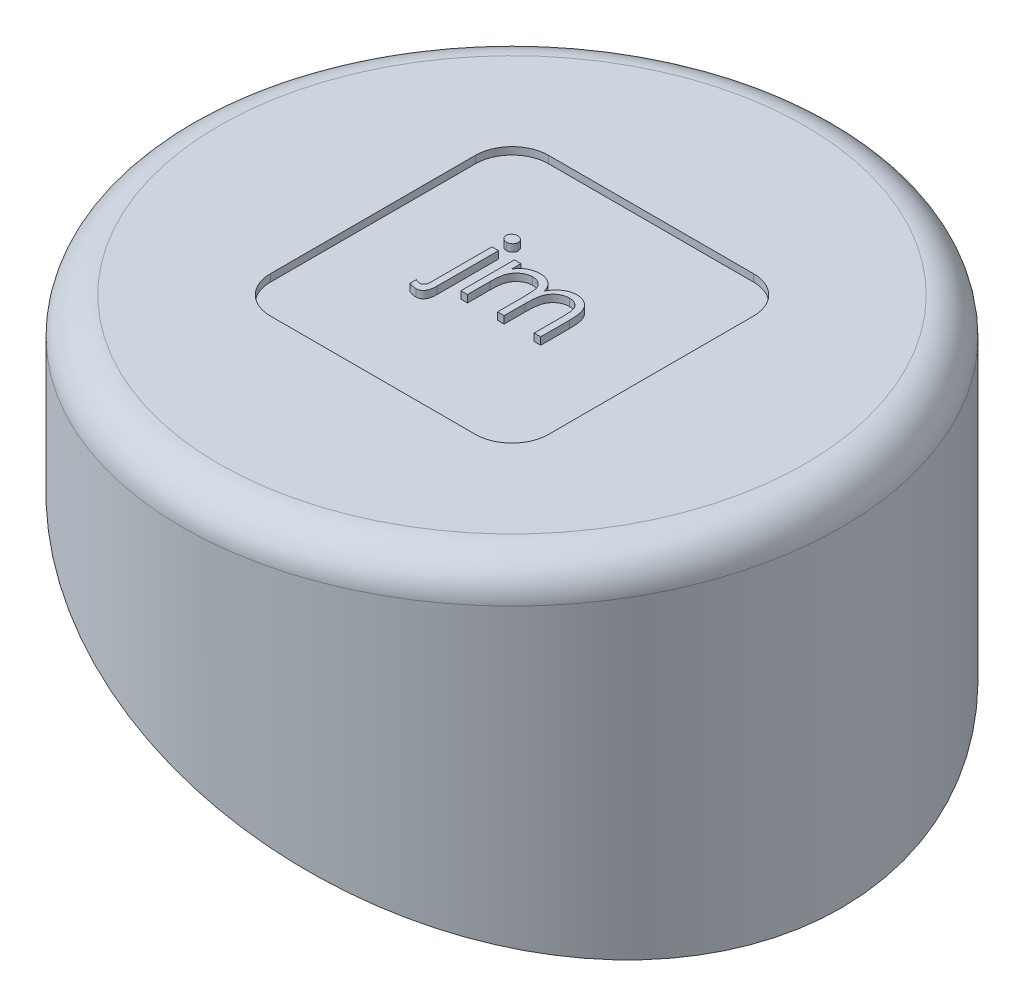
from build123d import *

# Parameters (mm, degrees)
SKETCH1_R                      = 45
BOSS_EXTRUDE1_DEPTH            = 50
CUT_EXTRUDE1_REACH             = 82.932
CUT_EXTRUDE1_DIRECTION_2_REACH = 82.932
FILLET1_R                      = 5
CUT_EXTRUDE2_DEPTH             = 1


# Read off the part's stored shape, not the designer's step: Shell1
with BuildPart() as part:
    # Sketch1 → Boss-Extrude1 (new body)
    with BuildSketch(Plane(origin=(0, 0, 0), x_dir=(1, 0, 0), z_dir=(0, 1, 0))):
        with Locations(Location((0, 0, 0), (0, 0, 270))):
            Circle(SKETCH1_R)
    extrude(amount=BOSS_EXTRUDE1_DEPTH)

    # Sketch2 → Cut-Extrude1 (cut, up to next)
    with BuildSketch(Plane.XY, mode=Mode.PRIVATE) as cut_extrude1_sk1:
        Polygon((45, 0), (-45, 0), (-45, 30.989485196), align=None)
    cut_extrude1_tool1 = extrude(cut_extrude1_sk1.sketch, amount=-CUT_EXTRUDE1_REACH, mode=Mode.PRIVATE) & part.part
    add(cut_extrude1_tool1.solids().sort_by_distance((-15, 10.329828, 0))[0], mode=Mode.SUBTRACT)

    # Sketch2 → Cut-Extrude1 direction 2 (cut, up to next)
    with BuildSketch(Plane.XY, mode=Mode.PRIVATE) as cut_extrude1_direction_2_sk1:
        Polygon((45, 0), (-45, 0), (-45, 30.989485196), align=None)
    cut_extrude1_direction_2_tool1 = extrude(cut_extrude1_direction_2_sk1.sketch, amount=CUT_EXTRUDE1_DIRECTION_2_REACH, mode=Mode.PRIVATE) & part.part
    add(cut_extrude1_direction_2_tool1.solids().sort_by_distance((-15, 10.329828, 0))[0], mode=Mode.SUBTRACT)

    # Fillet1
    fillet1_edges = [part.edges().sort_by_distance(p)[0] for p in [
        (0, 50, -45),
    ]]
    fillet(fillet1_edges, radius=FILLET1_R)

    # Shell1 outline → Shell1 (revolve, cut)
    with BuildSketch(Plane.XY):
        with BuildLine():
            Line((42.5, 0.853247443), (42.5, 45))
            ThreePointArc((42.5, 45), (41.767766953, 46.767766953), (40, 47.5))
            Line((40, 47.5), (0, 47.5))
            Line((0, 47.5), (0, 0.853247443))
            Line((0, 0.853247443), (42.5, 0.853247443))
        make_face()
    revolve(axis=Axis((0, 0, 0), (0, 1, 0)), mode=Mode.SUBTRACT)

    # Sketch3 → Cut-Extrude2 (cut)
    with BuildSketch(Plane(origin=(0, 50, 0), x_dir=(1, 0, 0), z_dir=(0, 1, 0))):
        with BuildLine():
            Line((-14, -19), (14, -19))
            ThreePointArc((14, -19), (17.535533906, -17.535533906), (19, -14))
            Line((19, -14), (19, 14))
            ThreePointArc((19, 14), (17.535533906, 17.535533906), (14, 19))
            Line((14, 19), (-14, 19))
            ThreePointArc((-14, 19), (-17.535533906, 17.535533906), (-19, 14))
            Line((-19, 14), (-19, -14))
            ThreePointArc((-19, -14), (-17.535533906, -17.535533906), (-14, -19))
        make_face()
        with BuildLine():
            add(Edge.make_bspline(
                [(-6.602564103, 7.384615385), (-6.546219207, 7.382051156), (-6.436523351, 7.377058951), (-6.278503166, 7.334172743), (-6.136327345, 7.259484797), (-6.009011428, 7.162468173), (-5.90222163, 7.045057839), (-5.824697029, 6.911307595), (-5.778834699, 6.764519327), (-5.772475164, 6.663112259), (-5.769230769, 6.611378205)],
                knots=[0, 0, 0, 0, 1.06928763, 2.081757757, 3.080304056, 4.102817284, 5.108909582, 6.075019406, 7.017947647, 8, 8, 8, 8], degree=3))
            add(Edge.make_bspline(
                [(-5.769230769, 6.611378205), (-5.772538286, 6.56098822), (-5.779063437, 6.461577616), (-5.824662885, 6.317314259), (-5.902869178, 6.185439169), (-6.008939934, 6.068256987), (-6.136346112, 5.971296003), (-6.278498143, 5.896593392), (-6.436524697, 5.85371111), (-6.546219664, 5.848718356), (-6.602564103, 5.846153846)],
                knots=[0, 0, 0, 0, 0.962634111, 1.899108286, 2.860048811, 3.872254101, 4.900980094, 5.905593535, 6.924215405, 8, 8, 8, 8], degree=3))
            add(Edge.make_bspline(
                [(-6.602564103, 5.846153846), (-6.658908541, 5.848718356), (-6.768603508, 5.85371111), (-6.926630062, 5.896593392), (-7.068782093, 5.971296003), (-7.196188271, 6.068256987), (-7.302259027, 6.185439169), (-7.38046532, 6.317314259), (-7.426064769, 6.461577616), (-7.432589919, 6.56098822), (-7.435897436, 6.611378205)],
                knots=[0, 0, 0, 0, 1.075784595, 2.094406465, 3.099019906, 4.127745899, 5.139951189, 6.100891714, 7.037365889, 8, 8, 8, 8], degree=3))
            add(Edge.make_bspline(
                [(-7.435897436, 6.611378205), (-7.432653041, 6.663112259), (-7.426293506, 6.764519327), (-7.380431176, 6.911307595), (-7.302906576, 7.045057839), (-7.196116777, 7.162468173), (-7.068800861, 7.259484797), (-6.926625039, 7.334172743), (-6.768604854, 7.377058951), (-6.658908998, 7.382051156), (-6.602564103, 7.384615385)],
                knots=[0, 0, 0, 0, 0.982052353, 1.924980594, 2.891090418, 3.897182716, 4.919695944, 5.918242243, 6.93071237, 8, 8, 8, 8], degree=3))
        make_face(mode=Mode.SUBTRACT)
        with BuildLine():
            Line((-7.051282051, 4.307692308), (-6.153846154, 4.307692308))
            Line((-6.153846154, 4.307692308), (-6.153846154, -4.067708333))
            add(Edge.make_bspline(
                [(-6.153846154, -4.067708333), (-6.154132606, -4.141869875), (-6.15468305, -4.284378053), (-6.172317042, -4.49016243), (-6.195192124, -4.680954673), (-6.228547736, -4.856533408), (-6.272681208, -5.016754586), (-6.326858883, -5.160593298), (-6.387799564, -5.291092499), (-6.463270778, -5.403491101), (-6.545332797, -5.502134381), (-6.634703123, -5.587487965), (-6.7308923, -5.660626224), (-6.836160171, -5.7180461), (-6.947081727, -5.765673789), (-7.066034551, -5.796368416), (-7.191389698, -5.817947311), (-7.277545042, -5.819643319), (-7.321714744, -5.820512821)],
                knots=[0, 0, 0, 0, 1.493029139, 2.868991889, 4.156754484, 5.362105958, 6.464967428, 7.499106053, 8.455465818, 9.358121702, 10.217355437, 11.035397588, 11.842309395, 12.643033568, 13.444773531, 14.266895717, 15.11148054, 16, 16, 16, 16], degree=3))
            add(Edge.make_bspline(
                [(-7.321714744, -5.820512821), (-7.399379833, -5.817829424), (-7.559893914, -5.812283524), (-7.806399323, -5.763785397), (-8.067320709, -5.692518214), (-8.242387038, -5.625144579), (-8.333333333, -5.590144231)],
                knots=[0, 0, 0, 0, 0.892368802, 1.844300437, 2.88012224, 4, 4, 4, 4], degree=3))
            Line((-8.333333333, -5.590144231), (-8.333333333, -4.726762821))
            add(Edge.make_bspline(
                [(-8.333333333, -4.726762821), (-8.276587466, -4.757025769), (-8.168310166, -4.814770775), (-8.002598459, -4.873223953), (-7.847373694, -4.916054943), (-7.745315187, -4.920799116), (-7.696314103, -4.923076923)],
                knots=[0, 0, 0, 0, 1.144578483, 2.183980519, 3.128079311, 4, 4, 4, 4], degree=3))
            add(Edge.make_bspline(
                [(-7.696314103, -4.923076923), (-7.639660339, -4.919438476), (-7.530400465, -4.912421532), (-7.378051109, -4.85186899), (-7.24962178, -4.749094843), (-7.190352916, -4.656726685), (-7.159455128, -4.608573718)],
                knots=[0, 0, 0, 0, 1.036054724, 1.998088038, 2.956371939, 4, 4, 4, 4], degree=3))
            add(Edge.make_bspline(
                [(-7.159455128, -4.608573718), (-7.141911229, -4.566290667), (-7.100858564, -4.467348473), (-7.072816103, -4.28222691), (-7.053144834, -4.04686094), (-7.051942097, -3.871484533), (-7.051282051, -3.775240385)],
                knots=[0, 0, 0, 0, 0.647276487, 1.514624746, 2.636060416, 4, 4, 4, 4], degree=3))
            Line((-7.051282051, -3.775240385), (-7.051282051, 4.307692308))
        make_face(mode=Mode.SUBTRACT)
        with BuildLine():
            Line((-3.974358974, 4.307692308), (-3.076923077, 4.307692308))
            Line((-3.076923077, 4.307692308), (-3.076923077, 3.037660256))
            add(Edge.make_bspline(
                [(-3.076923077, 3.037660256), (-2.996111791, 3.14876769), (-2.841269621, 3.361660184), (-2.587367757, 3.642203854), (-2.333721721, 3.880284296), (-2.151054916, 4.005263929), (-2.063301282, 4.065304487)],
                knots=[0, 0, 0, 0, 1.134379233, 2.173579362, 3.122582517, 4, 4, 4, 4], degree=3))
            add(Edge.make_bspline(
                [(-2.063301282, 4.065304487), (-1.943687962, 4.122462674), (-1.706551105, 4.235780426), (-1.331067605, 4.350733452), (-0.946854264, 4.421376598), (-0.687402224, 4.431037665), (-0.556891026, 4.435897436)],
                knots=[0, 0, 0, 0, 1.014936303, 2.012140481, 3.000054389, 4, 4, 4, 4], degree=3))
            add(Edge.make_bspline(
                [(-0.556891026, 4.435897436), (-0.468625321, 4.432910891), (-0.293952238, 4.427000679), (-0.035140552, 4.388543435), (0.215884053, 4.322068655), (0.457638423, 4.229476301), (0.685411792, 4.11734291), (0.894238071, 3.985772316), (1.081735809, 3.838066386), (1.247810241, 3.667555149), (1.397150314, 3.469450582), (1.534518447, 3.238409871), (1.661447625, 2.969245125), (1.731794222, 2.773912151), (1.768830128, 2.671073718)],
                knots=[0, 0, 0, 0, 1.009824226, 1.998387844, 2.986035974, 3.974953746, 4.955485308, 5.885931332, 6.793869504, 7.679848016, 8.601185859, 9.625726857, 10.749998409, 12, 12, 12, 12], degree=3))
            add(Edge.make_bspline(
                [(1.768830128, 2.671073718), (1.808005132, 2.741714916), (1.885096038, 2.880726873), (2.014540715, 3.077464765), (2.150162991, 3.26148417), (2.293118686, 3.432931097), (2.442903219, 3.590958898), (2.600221506, 3.736090046), (2.764178024, 3.868947799), (2.992155853, 4.024156826), (3.288763302, 4.189017345), (3.662729344, 4.331955756), (4.051729835, 4.420287551), (4.315780401, 4.430659759), (4.44911859, 4.435897436)],
                knots=[0, 0, 0, 0, 0.86119277, 1.694706429, 2.50939023, 3.298075842, 4.073795165, 4.829715201, 5.57930267, 6.321991688, 7.768977793, 9.186738141, 10.579381044, 12, 12, 12, 12], degree=3))
            add(Edge.make_bspline(
                [(4.44911859, 4.435897436), (4.571637055, 4.431276805), (4.811417587, 4.422233781), (5.160495489, 4.351223858), (5.486043504, 4.229287723), (5.787406579, 4.062905904), (6.05929176, 3.853822523), (6.295624072, 3.605054416), (6.494967967, 3.318361207), (6.625192652, 3.048669811), (6.713521979, 2.81056886), (6.767982648, 2.607693742), (6.816096063, 2.384403591), (6.856042478, 2.140431415), (6.885238341, 1.874915391), (6.906868956, 1.588290032), (6.921509167, 1.28033257), (6.922543659, 1.067859712), (6.923076923, 0.958333333)],
                knots=[0, 0, 0, 0, 1.209669288, 2.367440248, 3.500751976, 4.631527125, 5.755587489, 6.87532382, 8.007944318, 9.190864318, 9.82315674, 10.514484317, 11.263564316, 12.079023757, 12.955305781, 13.901327259, 14.918167583, 16, 16, 16, 16], degree=3))
            Line((6.923076923, 0.958333333), (6.923076923, -3))
            Line((6.923076923, -3), (6.025641026, -3))
            Line((6.025641026, -3), (6.025641026, 0.962339744))
            add(Edge.make_bspline(
                [(6.025641026, 0.962339744), (6.025418503, 1.055827098), (6.024990848, 1.235495574), (6.017294758, 1.493359721), (6.00279386, 1.72841217), (5.98583775, 1.940332422), (5.962284009, 2.129614675), (5.931867061, 2.295878728), (5.899645118, 2.440432474), (5.846113715, 2.600678325), (5.76054831, 2.777450355), (5.630212653, 2.968089143), (5.46601235, 3.134034286), (5.276411902, 3.27808662), (5.060559203, 3.395211309), (4.822659994, 3.478857051), (4.564191275, 3.530636703), (4.385269023, 3.535796748), (4.29286859, 3.538461538)],
                knots=[0, 0, 0, 0, 1.253487763, 2.409012846, 3.458416907, 4.410876679, 5.259312806, 6.014470957, 6.676830364, 7.243083969, 8.276244668, 9.299465089, 10.325150304, 11.392391894, 12.482080715, 13.603491619, 14.762376348, 16, 16, 16, 16], degree=3))
            add(Edge.make_bspline(
                [(4.29286859, 3.538461538), (4.179525863, 3.534415374), (3.955517545, 3.526418616), (3.628530442, 3.444778979), (3.314327537, 3.321692549), (3.0222843, 3.1433141), (2.75363347, 2.929575917), (2.522491819, 2.675434215), (2.331542717, 2.387920138), (2.202245643, 2.121786703), (2.120561925, 1.882731149), (2.06662788, 1.673881515), (2.024675333, 1.436505607), (1.985330964, 1.17219849), (1.959651741, 0.879140832), (1.936313535, 0.558688258), (1.925396784, 0.209876945), (1.923869759, -0.031913594), (1.923076923, -0.157451923)],
                knots=[0, 0, 0, 0, 1.090531906, 2.155305635, 3.229839962, 4.33261226, 5.44038871, 6.529323825, 7.629011124, 8.757537029, 9.370236727, 10.061839251, 10.834451254, 11.692844982, 12.636905849, 13.66920014, 14.789842145, 16, 16, 16, 16], degree=3))
            Line((1.923076923, -0.157451923), (1.923076923, -3))
            Line((1.923076923, -3), (1.025641026, -3))
            Line((1.025641026, -3), (1.025641026, 0.715945513))
            add(Edge.make_bspline(
                [(1.025641026, 0.715945513), (1.02541408, 0.820783566), (1.024977459, 1.022481444), (1.017330838, 1.311720516), (1.002797634, 1.574809317), (0.985996067, 1.81144207), (0.961824128, 2.021188724), (0.934367665, 2.205173747), (0.901943064, 2.362935893), (0.848257679, 2.535974135), (0.766216341, 2.726605344), (0.634249878, 2.929865404), (0.469656791, 3.107774254), (0.276597146, 3.259656393), (0.059438054, 3.385203482), (-0.18051452, 3.475659916), (-0.441099985, 3.528300743), (-0.620750573, 3.535010734), (-0.713141026, 3.538461538)],
                knots=[0, 0, 0, 0, 1.320475261, 2.540461679, 3.643808994, 4.639130445, 5.527981419, 6.302341397, 6.981980563, 7.553956391, 8.582137848, 9.585246428, 10.591171744, 11.620968678, 12.668337649, 13.738356861, 14.836885341, 16, 16, 16, 16], degree=3))
            add(Edge.make_bspline(
                [(-0.713141026, 3.538461538), (-0.821758773, 3.534088796), (-1.038230085, 3.525374074), (-1.356235713, 3.446933292), (-1.663337666, 3.324064507), (-1.954636805, 3.153607881), (-2.222277229, 2.942467656), (-2.456586564, 2.694139383), (-2.653565209, 2.411713573), (-2.784227537, 2.148386383), (-2.868508892, 1.915319883), (-2.924495562, 1.717174318), (-2.972608779, 1.497173609), (-3.008363126, 1.254639006), (-3.0428786, 0.991150165), (-3.059536626, 0.70539448), (-3.075741089, 0.397617087), (-3.076519417, 0.1851241), (-3.076923077, 0.074919872)],
                knots=[0, 0, 0, 0, 1.098833095, 2.189935336, 3.297829714, 4.440610912, 5.596351641, 6.740013378, 7.886572111, 9.072425424, 9.705826452, 10.395263256, 11.156850408, 11.985370555, 12.878090359, 13.847760091, 14.883794034, 16, 16, 16, 16], degree=3))
            Line((-3.076923077, 0.074919872), (-3.076923077, -3))
            Line((-3.076923077, -3), (-3.974358974, -3))
            Line((-3.974358974, -3), (-3.974358974, 4.307692308))
        make_face(mode=Mode.SUBTRACT)
    extrude(amount=-CUT_EXTRUDE2_DEPTH, mode=Mode.SUBTRACT)


solid = part.part
